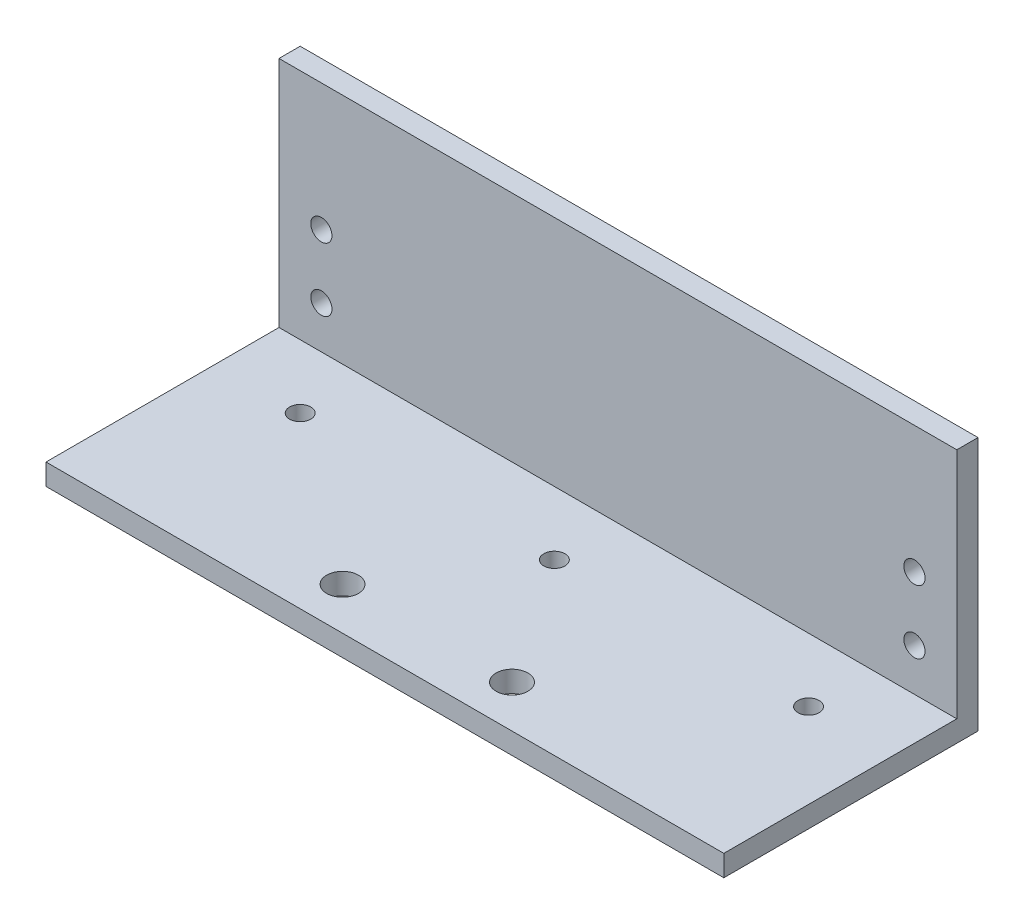
from build123d import *

# Parameters (mm, degrees)
BOSS_EXTRUDE2_DEPTH = 203.2
SKETCH4_R           = 3.175
CUT_EXTRUDE1_DEPTH  = 71.628
SKETCH5_R           = 3.175
CUT_EXTRUDE2_DEPTH  = 244.602
SKETCH6_R           = 4.7625
CUT_EXTRUDE3_DEPTH  = 28.702


with BuildPart() as part:
    # Sketch2 → Boss-Extrude2 (new body)
    with BuildSketch(Plane(origin=(0, 0, 0), x_dir=(0, 0, -1), z_dir=(1, 0, 0))):
        Polygon((0, 6.35), (0, 0), (76.2, 0), (76.2, 76.2), (69.85, 76.2), (69.85, 6.35), align=None)
    extrude(amount=BOSS_EXTRUDE2_DEPTH)

    # Sketch4 → Cut-Extrude1 (cut)
    with BuildSketch(Plane(origin=(0, 0, -76.2), x_dir=(-1, 0, 0), z_dir=(0, 0, -1))):
        with Locations((-190.5, 19.05)):
            Circle(SKETCH4_R)
        with Locations((-190.5, 38.1)):
            Circle(SKETCH4_R)
        with Locations((-12.7, 19.05)):
            Circle(SKETCH4_R)
        with Locations((-12.7, 38.1)):
            Circle(SKETCH4_R)
    extrude(amount=-CUT_EXTRUDE1_DEPTH, mode=Mode.SUBTRACT)

    # Sketch5 → Cut-Extrude2 (cut)
    with BuildSketch(Plane(origin=(0, 6.35, 0), x_dir=(1, 0, 0), z_dir=(0, 1, 0))):
        with Locations((25.4, 50.8)):
            Circle(SKETCH5_R)
        with Locations((177.8, 50.8)):
            Circle(SKETCH5_R)
        with Locations((101.6, 50.8)):
            Circle(SKETCH5_R)
    extrude(amount=-CUT_EXTRUDE2_DEPTH, mode=Mode.SUBTRACT)

    # Sketch6 → Cut-Extrude3 (cut)
    with BuildSketch(Plane(origin=(0, 6.35, 0), x_dir=(1, 0, 0), z_dir=(0, 1, 0))):
        with Locations((76.2, 12.7)):
            Circle(SKETCH6_R)
        with Locations((127, 12.7)):
            Circle(SKETCH6_R)
    extrude(amount=-CUT_EXTRUDE3_DEPTH, mode=Mode.SUBTRACT)


solid = part.part
